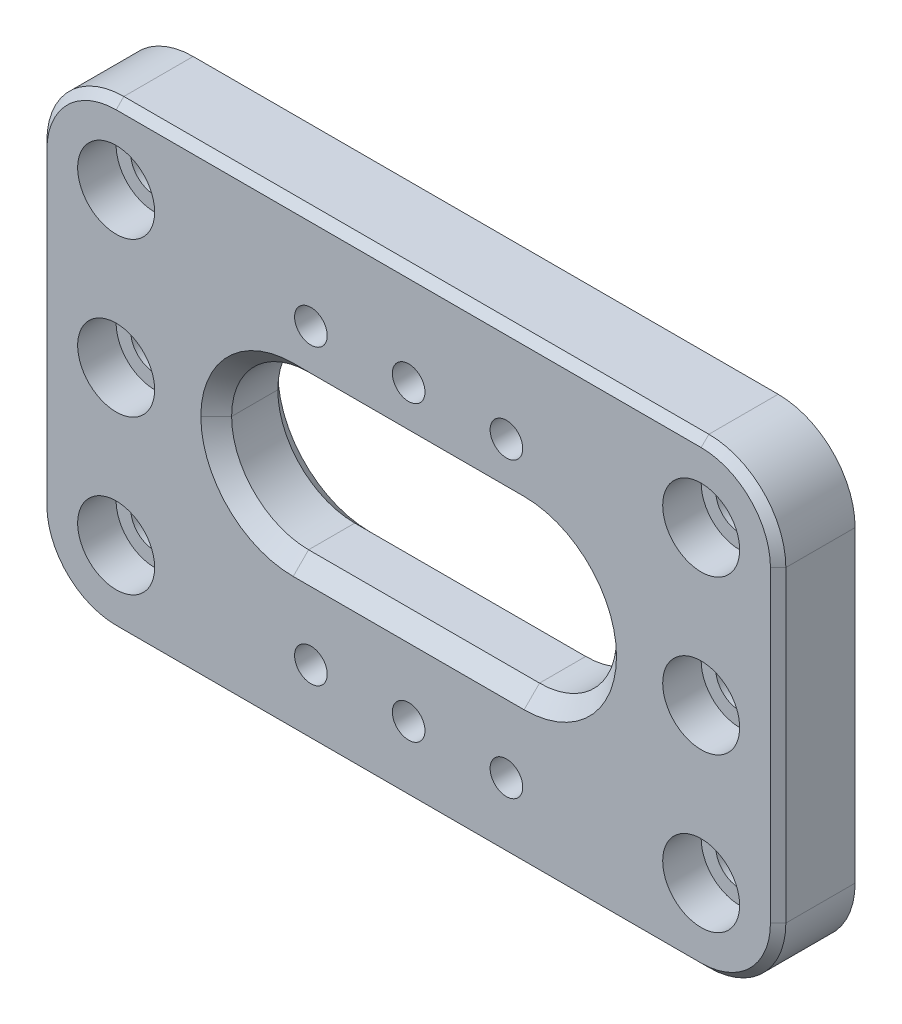
from build123d import *

# Parameters (mm, degrees)
SKETCH_1_W          = 96
SKETCH_1_H          = 60
EXTRUDE_1_DEPTH     = 10
FILLET_1_R          = 10
SKETCH_2_R          = 2.12
CUT_EXTRUDE_1_DEPTH = 10
SKETCH_3_R          = 5
CUT_EXTRUDE_2_DEPTH = 5
SKETCH_4_R          = 3.1
CUT_EXTRUDE_3_DEPTH = 5
CHAMFER_1_SIZE      = 1
CHAMFER_2_SIZE      = 1
SKETCH_5_W          = 50
SKETCH_5_H          = 20
CUT_EXTRUDE_4_DEPTH = 10
FILLET_2_R          = 10
CHAMFER_3_SIZE      = 2


with BuildPart() as part:
    # 草图1 → 凸台-拉伸1 (new body)
    with BuildSketch(Plane.XY):
        Rectangle(SKETCH_1_W, SKETCH_1_H)
    extrude(amount=EXTRUDE_1_DEPTH)

    # 圆角1
    fillet_1_edges = [part.edges().sort_by_distance(p)[0] for p in [
        (48, -30, 5),
        (-48, -30, 5),
        (-48, 30, 5),
        (48, 30, 5),
    ]]
    fillet(fillet_1_edges, radius=FILLET_1_R)

    # 草图2 → 切除-拉伸1 (cut)
    with BuildSketch(Plane.XY.offset(10)):
        with Locations((0, 17.3)):
            Circle(SKETCH_2_R)
        with Locations((-12.7, 17.3)):
            Circle(SKETCH_2_R)
        with Locations(Location((12.7, 17.3, 0), (0, 0, 180))):
            Circle(SKETCH_2_R)
        with Locations((-12.7, -20.8)):
            Circle(SKETCH_2_R)
        with Locations((0, -20.8)):
            Circle(SKETCH_2_R)
        with Locations((12.7, -20.8)):
            Circle(SKETCH_2_R)
    extrude(amount=-CUT_EXTRUDE_1_DEPTH, mode=Mode.SUBTRACT)

    # 草图3 → 切除-拉伸2 (cut)
    with BuildSketch(Plane.XY.offset(10)):
        with Locations((-38, 20)):
            Circle(SKETCH_3_R)
        with Locations((-38, 0)):
            Circle(SKETCH_3_R)
        with Locations((-38, -20)):
            Circle(SKETCH_3_R)
        with Locations(Location((38, -20, 0), (0, 0, 180))):
            Circle(SKETCH_3_R)
        with Locations(Location((38, 0, 0), (0, 0, 180))):
            Circle(SKETCH_3_R)
        with Locations(Location((38, 20, 0), (0, 0, 180))):
            Circle(SKETCH_3_R)
    extrude(amount=-CUT_EXTRUDE_2_DEPTH, mode=Mode.SUBTRACT)

    # 草图4 → 切除-拉伸3 (cut)
    with BuildSketch(Plane.XY.offset(5)):
        with Locations((-38, 20)):
            Circle(SKETCH_4_R)
        with Locations((-38, 0)):
            Circle(SKETCH_4_R)
        with Locations((-38, -20)):
            Circle(SKETCH_4_R)
        with Locations((38, 20)):
            Circle(SKETCH_4_R)
        with Locations((38, 0)):
            Circle(SKETCH_4_R)
        with Locations((38, -20)):
            Circle(SKETCH_4_R)
    extrude(amount=-CUT_EXTRUDE_3_DEPTH, mode=Mode.SUBTRACT)

    # 倒角1
    chamfer_1_edges = [part.edges().sort_by_distance(p)[0] for p in [
        (-41.1, 0, 0),
        (-41.1, -20, 0),
        (34.9, 20, 0),
        (34.9, 0, 0),
        (34.9, -20, 0),
        (-41.1, 20, 0),
    ]]
    chamfer(chamfer_1_edges, length=CHAMFER_1_SIZE)

    # 倒角2
    chamfer_2_edges = [part.edges().sort_by_distance(p)[0] for p in [
        (0, 30, 10),
        (48, 0, 10),
        (-48, 0, 10),
        (0, -30, 10),
        (-45.071067812, -27.071067812, 10),
        (45.071067812, -27.071067812, 10),
        (-45.071067812, 27.071067812, 10),
        (45.071067812, 27.071067812, 10),
    ]]
    chamfer(chamfer_2_edges, length=CHAMFER_2_SIZE)

    # 草图5 → 切除-拉伸4 (cut)
    with BuildSketch(Plane.XY.offset(10)):
        Rectangle(SKETCH_5_W, SKETCH_5_H)
    extrude(amount=-CUT_EXTRUDE_4_DEPTH, mode=Mode.SUBTRACT)

    # 圆角2
    fillet_2_edges = [part.edges().sort_by_distance(p)[0] for p in [
        (25, -10, 5),
        (25, 10, 5),
        (-25, -10, 5),
        (-25, 10, 5),
    ]]
    fillet(fillet_2_edges, radius=FILLET_2_R - 0.0001)  # a hair under: the kernel refuses the full size

    # 倒角3
    chamfer_3_edges = [part.edges().sort_by_distance(p)[0] for p in [
        (0, -10, 10),
        (0, -10, 0),
        (0, 10, 10),
        (0, 10, 0),
        (22.071097101, -7.071097101, 10),
        (22.071097101, -7.071097101, 0),
        (22.071097101, 7.071097101, 10),
        (22.071097101, 7.071097101, 0),
        (-22.071097101, -7.071097101, 10),
        (-22.071097101, -7.071097101, 0),
        (-22.071097101, 7.071097101, 10),
        (-22.071097101, 7.071097101, 0),
    ]]
    chamfer(chamfer_3_edges, length=CHAMFER_3_SIZE)


solid = part.part
